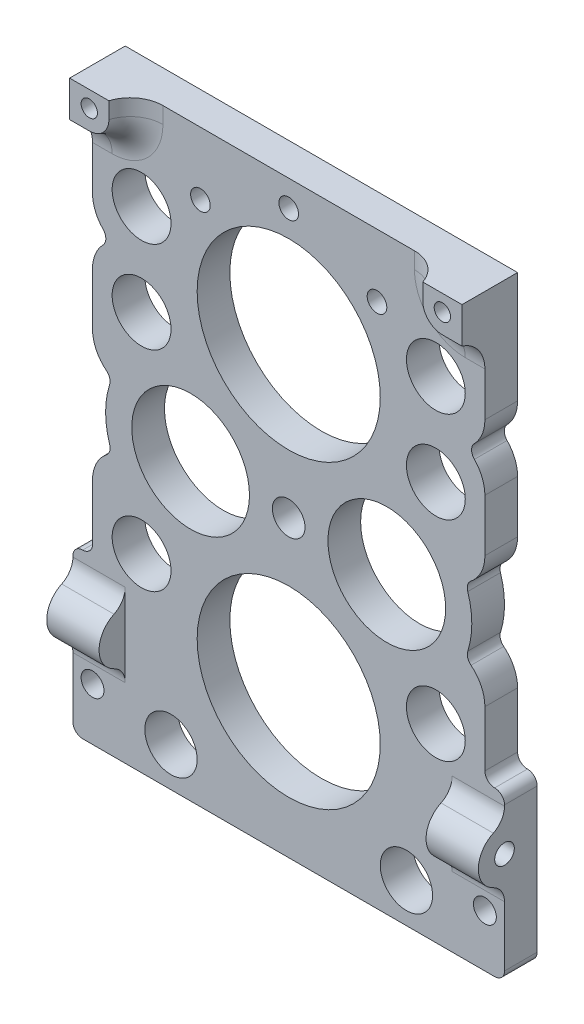
from build123d import *

# Parameters (mm, degrees)
SKETCH1_W            = 60
SKETCH1_H            = 90
BOSS_EXTRUDE1_DEPTH  = 5
SKETCH2_W            = 5
SKETCH2_H            = 25
BOSS_EXTRUDE2_DEPTH  = 3
SKETCH3_R            = 14
SKETCH3_R_2          = 9
SKETCH3_R_3          = 4.5
SKETCH3_R_4          = 4
SKETCH3_R_5          = 2.5
CUT_EXTRUDE1_DEPTH   = 57.026779311
SKETCH4_R            = 1.75
CUT_EXTRUDE2_DEPTH   = 57.026779311
FILLET1_R            = 1.5
FILLET2_R            = 1.5
BOSS_EXTRUDE3_DEPTH  = 3.5
SKETCH6_R            = 1.25
CUT_EXTRUDE3_DEPTH   = 57.446877835
FILLET3_R            = 5
FILLET3_OF_MIRROR2_R = 5
SKETCH12_R           = 1.5
CUT_EXTRUDE7_DEPTH   = 57.44687782
BOSS_EXTRUDE5_DEPTH  = 8
FILLET5_R            = 3
SKETCH15_R           = 1.5
CUT_EXTRUDE8_DEPTH   = 5
FILLET5_OF_MIRROR3_R = 3


# Some blends are built 0.0001 mm under size
with BuildPart() as part:
    # Sketch1 → Boss-Extrude1 (new body)
    with BuildSketch(Plane.XY):
        Rectangle(SKETCH1_W, SKETCH1_H)
    extrude(amount=BOSS_EXTRUDE1_DEPTH)

    # Sketch2 → Boss-Extrude2 (add)
    with BuildSketch(Plane(origin=(30, 0, 0), x_dir=(0, 0, -1), z_dir=(1, 0, 0))):
        with Locations((-2.5, -32.5)):
            Rectangle(SKETCH2_W, SKETCH2_H)
    boss_extrude2 = extrude(amount=BOSS_EXTRUDE2_DEPTH)

    # Mirror1: Boss-Extrude2 across plane
    add(boss_extrude2.mirror(Plane(origin=(0, 0, 0), x_dir=(0, 0, 1), z_dir=(1, 0, 0))))

    # Sketch3 → Cut-Extrude1 (cut, through all)
    with BuildSketch(Plane.XY.offset(5)):
        with Locations((0, -23)):
            Circle(SKETCH3_R)
        with Locations((0, 23)):
            Circle(SKETCH3_R)
        with Locations((15, 0)):
            Circle(SKETCH3_R_2)
        with Locations((-15, 0)):
            Circle(SKETCH3_R_2)
        with Locations((-22.5, -16)):
            Circle(SKETCH3_R_3)
        with Locations((-18, -39)):
            Circle(SKETCH3_R_4)
        with Locations((22.5, -16)):
            Circle(SKETCH3_R_3)
        with Locations((18, -39)):
            Circle(SKETCH3_R_4)
        with Locations((22.5, 16)):
            Circle(SKETCH3_R_3)
        with Locations((22.5, 30)):
            Circle(SKETCH3_R_3)
        with Locations((-22.5, 30)):
            Circle(SKETCH3_R_3)
        with Locations((-22.5, 16)):
            Circle(SKETCH3_R_3)
        Circle(SKETCH3_R_5)
        with BuildLine():
            Line((30, -10), (30, 10))
            ThreePointArc((30, 10), (29.192459912, 7.084524053), (27, 5))
            ThreePointArc((27, 5), (28, 0), (27, -5))
            ThreePointArc((27, -5), (29.192459912, -7.084524053), (30, -10))
        make_face()
        with BuildLine():
            Line((30, 18), (30, 28))
            ThreePointArc((30, 28), (29.192459912, 25.084524053), (27, 23))
            ThreePointArc((27, 23), (29.192459912, 20.915475947), (30, 18))
        make_face()
        with BuildLine():
            Line((-30, 18), (-30, 28))
            ThreePointArc((-30, 28), (-29.192459912, 25.084524053), (-27, 23))
            ThreePointArc((-27, 23), (-29.192459912, 20.915475947), (-30, 18))
        make_face()
        with BuildLine():
            Line((-30, -10), (-30, 10))
            ThreePointArc((-30, 10), (-29.192459912, 7.084524053), (-27, 5))
            ThreePointArc((-27, 5), (-28, 0), (-27, -5))
            ThreePointArc((-27, -5), (-29.192459912, -7.084524053), (-30, -10))
        make_face()
    extrude(amount=-CUT_EXTRUDE1_DEPTH, mode=Mode.SUBTRACT)

    # Sketch4 → Cut-Extrude2 (cut, through all)
    with BuildSketch(Plane.XY.offset(5)):
        with Locations((-30, -37)):
            Circle(SKETCH4_R)
        with Locations((30, -37)):
            Circle(SKETCH4_R)
    extrude(amount=-CUT_EXTRUDE2_DEPTH, mode=Mode.SUBTRACT)

    # Fillet1
    fillet1_edges = [part.edges().sort_by_distance(p)[0] for p in [
        (-33, -20, 2.5),
        (-33, -45, 2.5),
        (-30, -20, 2.5),
        (33, -45, 2.5),
        (33, -20, 2.5),
        (30, -20, 2.5),
    ]]
    fillet(fillet1_edges, radius=FILLET1_R - 0.0001)  # a hair under: the kernel refuses the full size

    # Fillet2
    fillet2_edges = [part.edges().sort_by_distance(p)[0] for p in [
        (27, -5, 2.5),
        (27, 5, 2.5),
        (27, 23, 2.5),
        (-27, 23, 2.5),
        (-27, -5, 2.5),
        (-27, 5, 2.5),
    ]]
    fillet(fillet2_edges, radius=FILLET2_R)

    # Sketch5 → Boss-Extrude3 (add)
    with BuildSketch(Plane.XY.offset(5)):
        with BuildLine():
            Line((24, 45), (30, 45))
            Line((30, 45), (30, 39.5))
            Line((30, 39.5), (27, 39.5))
            ThreePointArc((27, 39.5), (24.878679656, 40.378679656), (24, 42.5))
            Line((24, 42.5), (24, 45))
        make_face()
    boss_extrude3 = extrude(amount=BOSS_EXTRUDE3_DEPTH)

    # Sketch6 → Cut-Extrude3 (cut, through all)
    with BuildSketch(Plane.XY.offset(8.5)):
        with Locations((27, 42.5)):
            Circle(SKETCH6_R)
    cut_extrude3 = extrude(amount=-CUT_EXTRUDE3_DEPTH, mode=Mode.SUBTRACT)

    # Fillet3
    # the kernel refuses this fillet: 5 mm, written as the material it adds along each edge
    with BuildSketch(Plane(origin=(24, 42.5, 5), x_dir=(-1, 0, 0), z_dir=(0, 1, 0))) as fillet3_piece_1:
        with BuildLine():
            CenterArc((4.769696007, 5), FILLET3_R, 197.457603124, 72.542396876)
            Line((0, 3.5), (-0.09539392, 3.47))
            ThreePointArc((-0.09539392, 3.47), (-0.1, 1.75), (-0.1, 0))
            Line((-0.1, 0), (0, -0.1))
            Line((0, -0.1), (4.769696007, -0.1))
            Line((4.769696007, -0.1), (4.769696007, 0))
        make_face()
    extrude(amount=2.5)
    with BuildSketch(Plane(origin=(27, 42.5, 5), x_dir=(0, -1, 0), z_dir=(1, 0, 0))) as fillet3_piece_2:
        with BuildLine():
            CenterArc((7.769696007, -5), FILLET3_R, 90, 72.542396876)
            Line((3, -3.5), (2.90460608, -3.47))
            ThreePointArc((2.90460608, -3.47), (2.9, -1.75), (2.9, 0))
            Line((2.9, 0), (3, 0.1))
            Line((3, 0.1), (7.769696007, 0.1))
            Line((7.769696007, 0.1), (7.769696007, 0))
        make_face()
    revolve(axis=Axis((27, 42.5, 5), (0, 0, -1)), revolution_arc=90)
    with BuildSketch(Plane(origin=(30, 39.5, 5), x_dir=(0, -1, 0), z_dir=(-1, 0, 0))) as fillet3_piece_3:
        with BuildLine():
            CenterArc((4.769696007, 5), FILLET3_R, 197.457603124, 72.542396876)
            Line((0, 3.5), (-0.09539392, 3.47))
            ThreePointArc((-0.09539392, 3.47), (-0.1, 1.75), (-0.1, 0))
            Line((-0.1, 0), (0, -0.1))
            Line((0, -0.1), (4.769696007, -0.1))
            Line((4.769696007, -0.1), (4.769696007, 0))
        make_face()
    extrude(amount=3)

    # Mirror2: Boss-Extrude3, Cut-Extrude3 across plane
    add(boss_extrude3.mirror(Plane(origin=(0, 0, 0), x_dir=(0, 0, 1), z_dir=(1, 0, 0))))
    add(cut_extrude3.mirror(Plane(origin=(0, 0, 0), x_dir=(0, 0, 1), z_dir=(1, 0, 0))), mode=Mode.SUBTRACT)

    # Fillet3 of Mirror2
    # the kernel refuses this fillet: 5 mm, written as the material it adds along each edge
    with BuildSketch(Plane(origin=(-24, 42.5, 5), x_dir=(1, 0, 0), z_dir=(0, 1, 0))) as fillet3_of_mirror2_piece_1:
        with BuildLine():
            CenterArc((4.769696007, -5), FILLET3_OF_MIRROR2_R, 90, 72.542396876)
            Line((0, -3.5), (-0.09539392, -3.47))
            ThreePointArc((-0.09539392, -3.47), (-0.1, -1.75), (-0.1, 0))
            Line((-0.1, 0), (0, 0.1))
            Line((0, 0.1), (4.769696007, 0.1))
            Line((4.769696007, 0.1), (4.769696007, 0))
        make_face()
    extrude(amount=2.5)
    with BuildSketch(Plane(origin=(-27, 42.5, 5), x_dir=(0, -1, 0), z_dir=(-1, 0, 0))) as fillet3_of_mirror2_piece_2:
        with BuildLine():
            CenterArc((7.769696007, 5), FILLET3_OF_MIRROR2_R, 197.457603124, 72.542396876)
            Line((3, 3.5), (2.90460608, 3.47))
            ThreePointArc((2.90460608, 3.47), (2.9, 1.75), (2.9, 0))
            Line((2.9, 0), (3, -0.1))
            Line((3, -0.1), (7.769696007, -0.1))
            Line((7.769696007, -0.1), (7.769696007, 0))
        make_face()
    revolve(axis=Axis((-27, 42.5, 5), (0, 0, 1)), revolution_arc=90)
    with BuildSketch(Plane(origin=(-30, 39.5, 5), x_dir=(0, -1, 0), z_dir=(1, 0, 0))) as fillet3_of_mirror2_piece_3:
        with BuildLine():
            CenterArc((4.769696007, -5), FILLET3_OF_MIRROR2_R, 90, 72.542396876)
            Line((0, -3.5), (-0.09539392, -3.47))
            ThreePointArc((-0.09539392, -3.47), (-0.1, -1.75), (-0.1, 0))
            Line((-0.1, 0), (0, 0.1))
            Line((0, 0.1), (4.769696007, 0.1))
            Line((4.769696007, 0.1), (4.769696007, 0))
        make_face()
    extrude(amount=3)

    # Sketch12 → Cut-Extrude7 (cut, through all)
    with BuildSketch(Plane(origin=(0, 0, 0), x_dir=(-1, 0, 0), z_dir=(0, 0, -1))):
        with Locations((-13.5, 35.369741957)):
            Circle(SKETCH12_R)
        with Locations((0, 41)):
            Circle(SKETCH12_R)
        with Locations((13.5, 35.369741957)):
            Circle(SKETCH12_R)
    extrude(amount=-CUT_EXTRUDE7_DEPTH, mode=Mode.SUBTRACT)

    # Sketch14 → Boss-Extrude5 (add)
    with BuildSketch(Plane(origin=(33, 0, 0), x_dir=(0, 0, -1), z_dir=(1, 0, 0))):
        with BuildLine():
            Line((-5, -24), (-5, -32))
            ThreePointArc((-5, -32), (-9, -28), (-5, -24))
        make_face()
    boss_extrude5 = extrude(amount=-BOSS_EXTRUDE5_DEPTH)

    # Fillet5
    fillet5_edges = [part.edges().sort_by_distance(p)[0] for p in [
        (29, -32, 5),
        (29, -24, 5),
    ]]
    fillet(fillet5_edges, radius=FILLET5_R)

    # Sketch15 → Cut-Extrude8 (cut)
    with BuildSketch(Plane(origin=(33, 0, 0), x_dir=(0, 0, -1), z_dir=(1, 0, 0))):
        with Locations((-5, -28)):
            Circle(SKETCH15_R)
    cut_extrude8 = extrude(amount=-CUT_EXTRUDE8_DEPTH, mode=Mode.SUBTRACT)

    # Mirror3: Boss-Extrude5, Cut-Extrude8 across plane
    add(boss_extrude5.mirror(Plane(origin=(0, 0, 0), x_dir=(0, 0, 1), z_dir=(1, 0, 0))))
    add(cut_extrude8.mirror(Plane(origin=(0, 0, 0), x_dir=(0, 0, 1), z_dir=(1, 0, 0))), mode=Mode.SUBTRACT)

    # Fillet5 of Mirror3
    fillet5_of_mirror3_edges = [part.edges().sort_by_distance(p)[0] for p in [
        (-29, -32, 5),
        (-29, -24, 5),
    ]]
    fillet(fillet5_of_mirror3_edges, radius=FILLET5_OF_MIRROR3_R)


solid = part.part
